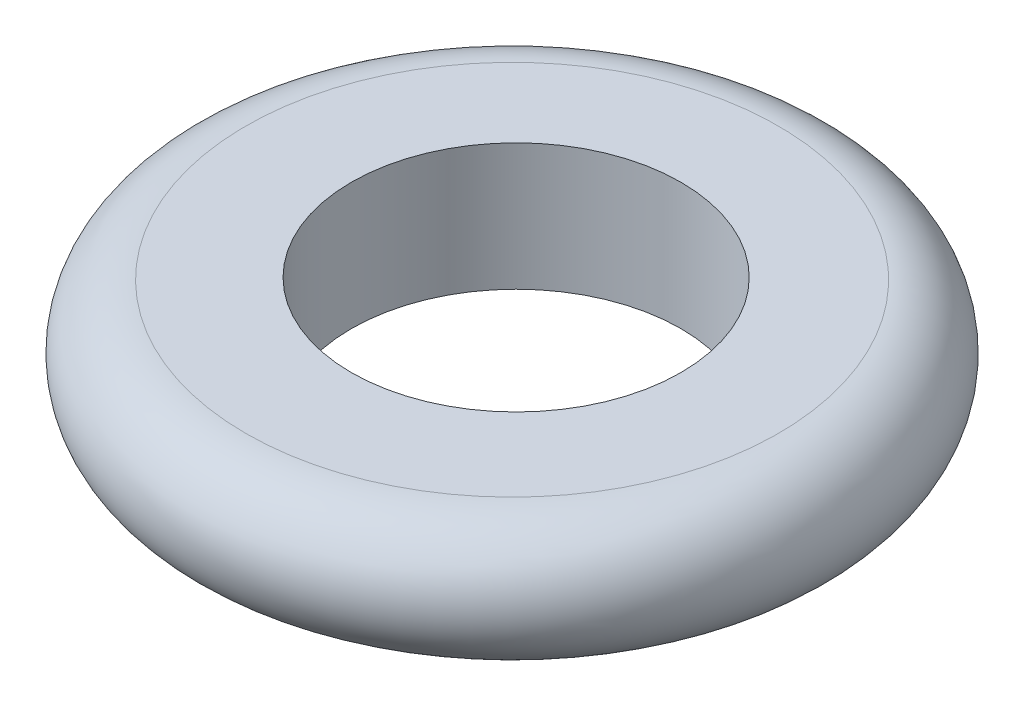
from build123d import *

# Parameters (mm, degrees)
ESQUISSE1_R        = 13
ESQUISSE1_R_2      = 6.5
BOSS_EXTRU_1_DEPTH = 5
CONG_4_R           = 2.5


with BuildPart() as part:
    # Esquisse1 → Boss.-Extru.1 (new body)
    with BuildSketch(Plane(origin=(0, 0, 0), x_dir=(1, 0, 0), z_dir=(0, 1, 0))):
        with Locations(Location((0, 0, 0), (0, 0, 270))):
            Circle(ESQUISSE1_R)
        with Locations(Location((0, 0.159304864, 0), (0, 0, 270))):
            Circle(ESQUISSE1_R_2, mode=Mode.SUBTRACT)
    extrude(amount=BOSS_EXTRU_1_DEPTH)

    # Congé4
    cong_4_edges = [part.edges().sort_by_distance(p)[0] for p in [
        (0, 0, -13),
        (0, 5, -13),
    ]]
    fillet(cong_4_edges, radius=CONG_4_R - 0.0001)  # a hair under: the kernel refuses the full size


solid = part.part
